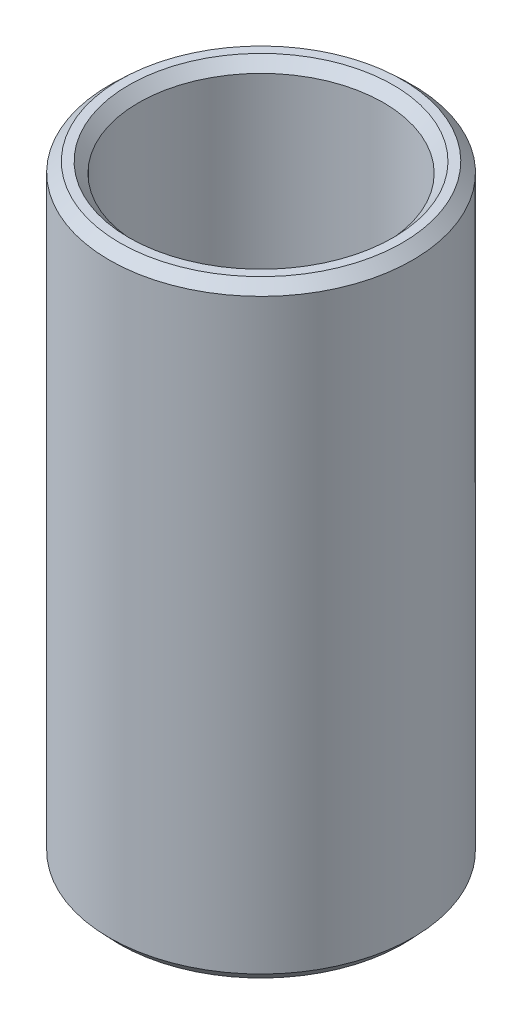
from build123d import *
from OCP.BRepFilletAPI import BRepFilletAPI_MakeChamfer

# Parameters (mm, degrees)
SKETCH1_R           = 57.5
BOSS_EXTRUDE1_DEPTH = 230.197861075
SKETCH2_R           = 46.429396427
CUT_EXTRUDE1_DEPTH  = 245.138393629
CHAMFER1_SIZE       = 3.707562958
CHAMFER1_SIZE2      = 3.935280895


with BuildPart() as part:
    # Sketch1 → Boss-Extrude1 (new body)
    with BuildSketch(Plane(origin=(0, 0, 0), x_dir=(1, 0, 0), z_dir=(0, 1, 0))):
        Circle(SKETCH1_R)
    extrude(amount=BOSS_EXTRUDE1_DEPTH)

    # Sketch2 → Cut-Extrude1 (cut, through all)
    with BuildSketch(Plane(origin=(0, 0, 0), x_dir=(1, 0, 0), z_dir=(0, 1, 0))):
        Circle(SKETCH2_R)
    extrude(amount=CUT_EXTRUDE1_DEPTH, mode=Mode.SUBTRACT)

    # Chamfer1: one chamfer whose edges measure the first distance from different faces: ONE call of the kernel's chamfer builder (chamfer() names one face for all edges)
    chamfer1_edges_1 = [part.edges().sort_by_distance(p)[0] for p in [
        (-46.429396427, 230.197861075, 0),
    ]]
    chamfer1_side_1 = [part.faces().sort_by_distance(p)[0] for p in [
        (-55.873654403, 230.197861075, 0),
    ]]
    chamfer1_edges_2 = [part.edges().sort_by_distance(p)[0] for p in [
        (-46.429396427, 0, 0),
    ]]
    chamfer1_side_2 = [part.faces().sort_by_distance(p)[0] for p in [
        (-46.429396427, 115.098930538, 0),
    ]]
    chamfer1_edges_3 = [part.edges().sort_by_distance(p)[0] for p in [
        (-57.5, 0, 0),
    ]]
    chamfer1_side_3 = [part.faces().sort_by_distance(p)[0] for p in [
        (-55.873654403, 0, 0),
    ]]
    chamfer1_edges_4 = [part.edges().sort_by_distance(p)[0] for p in [
        (-57.5, 230.197861075, 0),
    ]]
    chamfer1_side_4 = [part.faces().sort_by_distance(p)[0] for p in [
        (-57.5, 115.098930538, 0),
    ]]
    chamfer1 = BRepFilletAPI_MakeChamfer(part.part.solid().wrapped)
    for e in chamfer1_edges_1:
        chamfer1.Add(CHAMFER1_SIZE, CHAMFER1_SIZE2, e.wrapped, chamfer1_side_1[0].wrapped)  # the first distance lies on this face
    for e in chamfer1_edges_2:
        chamfer1.Add(CHAMFER1_SIZE, CHAMFER1_SIZE2, e.wrapped, chamfer1_side_2[0].wrapped)  # the first distance lies on this face
    for e in chamfer1_edges_3:
        chamfer1.Add(CHAMFER1_SIZE, CHAMFER1_SIZE2, e.wrapped, chamfer1_side_3[0].wrapped)  # the first distance lies on this face
    for e in chamfer1_edges_4:
        chamfer1.Add(CHAMFER1_SIZE, CHAMFER1_SIZE2, e.wrapped, chamfer1_side_4[0].wrapped)  # the first distance lies on this face
    add(Compound.cast(chamfer1.Shape()), mode=Mode.REPLACE)


solid = part.part
